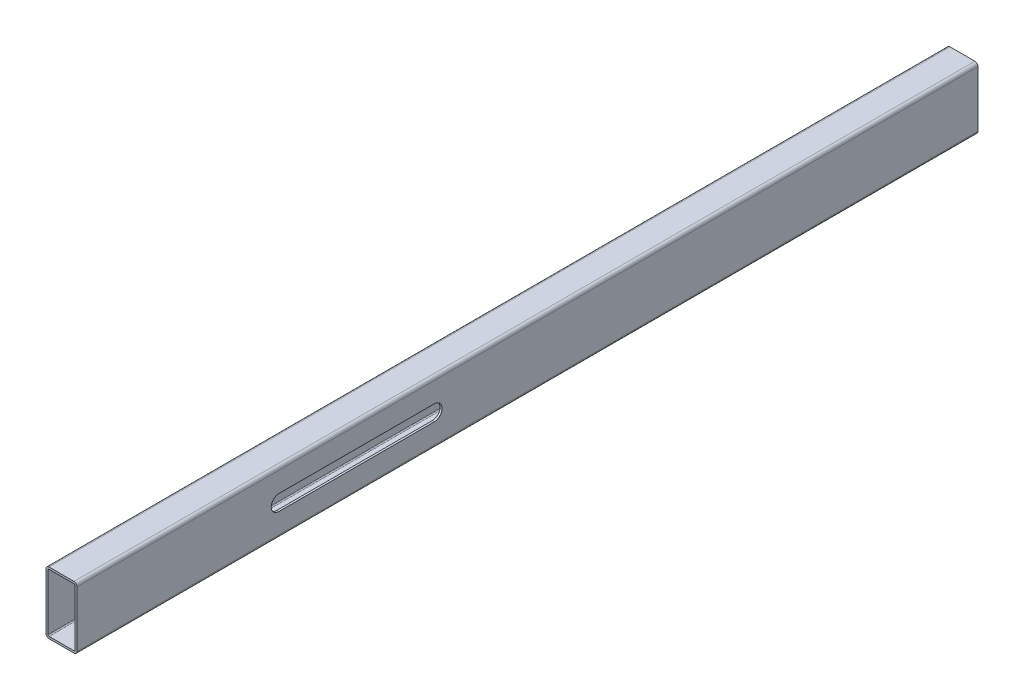
from build123d import *

# Parameters (mm, degrees)
EXTRUDE_THIN1_DEPTH = 736.6
CUT_EXTRUDE2_DEPTH  = 738.475341961


with BuildPart() as part:
    # Sketch1 → Extrude-Thin1 (new body)
    with BuildSketch(Plane.XY):
        with BuildLine():
            Line((-10.16, 25.4), (10.16, 25.4))
            ThreePointArc((10.16, 25.4), (11.956051224, 24.656051224), (12.7, 22.86))
            Line((12.7, 22.86), (12.7, -22.86))
            ThreePointArc((12.7, -22.86), (11.956051224, -24.656051224), (10.16, -25.4))
            Line((10.16, -25.4), (-10.16, -25.4))
            ThreePointArc((-10.16, -25.4), (-11.956051224, -24.656051224), (-12.7, -22.86))
            Line((-12.7, -22.86), (-12.7, 22.86))
            ThreePointArc((-12.7, 22.86), (-11.956051224, 24.656051224), (-10.16, 25.4))
        make_face()
        with BuildLine():
            Line((-10.16, 23.749), (10.16, 23.749))
            ThreePointArc((10.16, 23.749), (10.788617928, 23.488617928), (11.049, 22.86))
            Line((11.049, 22.86), (11.049, -22.86))
            ThreePointArc((11.049, -22.86), (10.788617928, -23.488617928), (10.16, -23.749))
            Line((10.16, -23.749), (-10.16, -23.749))
            ThreePointArc((-10.16, -23.749), (-10.788617928, -23.488617928), (-11.049, -22.86))
            Line((-11.049, -22.86), (-11.049, 22.86))
            ThreePointArc((-11.049, 22.86), (-10.788617928, 23.488617928), (-10.16, 23.749))
        make_face(mode=Mode.SUBTRACT)
    extrude(amount=EXTRUDE_THIN1_DEPTH)

    # Sketch3 → Cut-Extrude2 (cut, through all)
    with BuildSketch(Plane.ZY.offset(12.7)):
        with BuildLine():
            Line((571.5, -6.35), (444.5, -6.35))
            ThreePointArc((444.5, -6.35), (438.15, 0), (444.5, 6.35))
            Line((444.5, 6.35), (571.5, 6.35))
            ThreePointArc((571.5, 6.35), (577.85, 0), (571.5, -6.35))
        make_face()
    extrude(amount=-CUT_EXTRUDE2_DEPTH, mode=Mode.SUBTRACT)


solid = part.part
